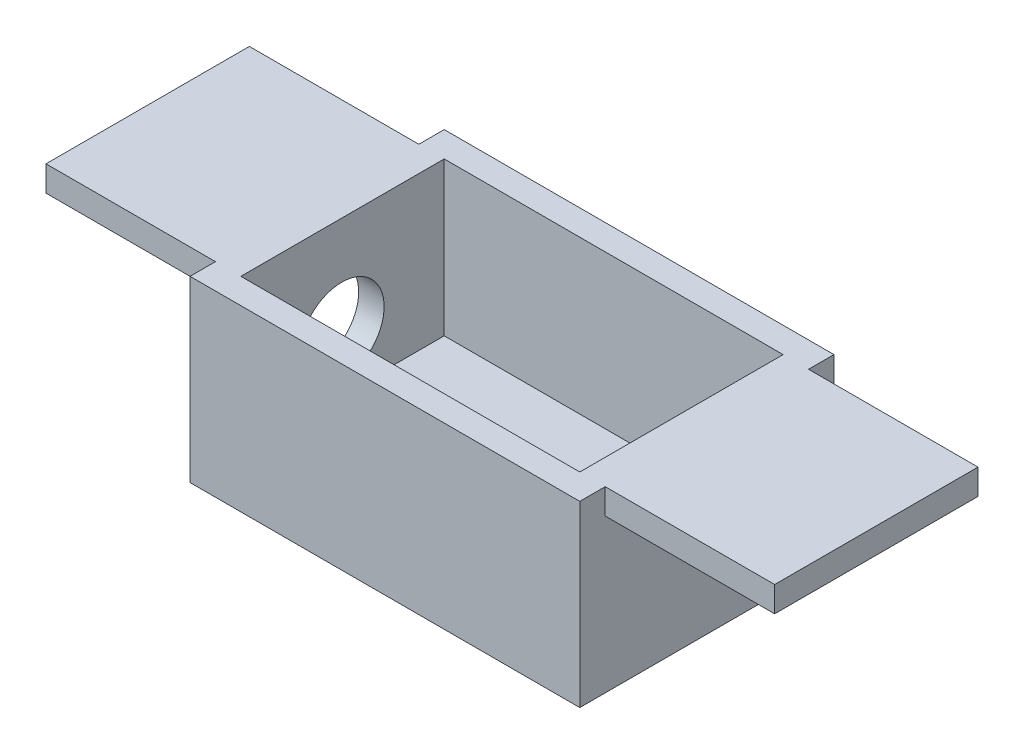
from build123d import *

# Parameters (mm, degrees)
EXTRUDE_1_DEPTH     = 24
SKETCH_2_W          = 46
SKETCH_2_H          = 21.081573772
EXTRUDE_2_DEPTH     = 3
SKETCH_3_W          = 46
SKETCH_3_H          = 21.081573772
EXTRUDE_3_DEPTH     = 3
SKETCH_6_R          = 5
CUT_EXTRUDE_2_DEPTH = 10


with BuildPart() as part:
    # 草图1 → 凸台-拉伸1 (new body)
    with BuildSketch(Plane.XY):
        Polygon((-66, 28.893533875), (-43, 28.893533875), (-43, 10.811960103), (-3, 10.811960103), (-3, 28.893533875), (20, 28.893533875), (20, 25.893533875), (0, 25.893533875), (0, 7.811960103), (-46, 7.811960103), (-46, 25.893533875), (-66, 25.893533875), align=None)
    extrude(amount=EXTRUDE_1_DEPTH)

    # 草图2 → 凸台-拉伸2 (add)
    with BuildSketch(Plane.XY.offset(24)):
        with Locations((-23, 18.352746989)):
            Rectangle(SKETCH_2_W, SKETCH_2_H)
    extrude(amount=EXTRUDE_2_DEPTH)

    # 草图3 → 凸台-拉伸3 (add)
    with BuildSketch(Plane(origin=(0, 0, 0), x_dir=(-1, 0, 0), z_dir=(0, 0, -1))):
        with Locations((23, 18.352746989)):
            Rectangle(SKETCH_3_W, SKETCH_3_H)
    extrude(amount=EXTRUDE_3_DEPTH)

    # 草图6 → 切除-拉伸2 (cut)
    with BuildSketch(Plane.ZY.offset(46)):
        with Locations((12.093557596, 17.339206361)):
            Circle(SKETCH_6_R)
    extrude(amount=-CUT_EXTRUDE_2_DEPTH, mode=Mode.SUBTRACT)


solid = part.part
